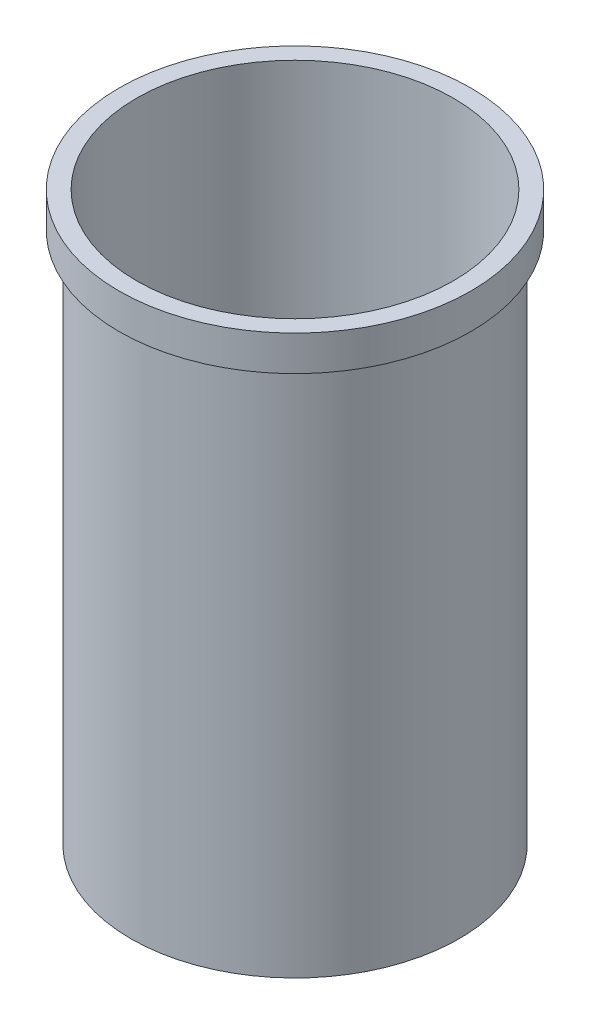
from build123d import *

# Parameters (mm, degrees)
SKETCH1_R           = 56.1
SKETCH1_R_2         = 54.1
BOSS_EXTRUDE1_DEPTH = 193.66
BOSS_EXTRUDE2_START = -12
SKETCH3_R           = 60.1
SKETCH3_R_2         = 56.1
BOSS_EXTRUDE2_DEPTH = 12


with BuildPart() as part:
    # Sketch1 → Boss-Extrude1 (new body)
    with BuildSketch(Plane(origin=(0, 0, 0), x_dir=(1, 0, 0), z_dir=(0, 1, 0))):
        Circle(SKETCH1_R)
        Circle(SKETCH1_R_2, mode=Mode.SUBTRACT)
    extrude(amount=BOSS_EXTRUDE1_DEPTH)

    # Sketch3 → Boss-Extrude2 (add)
    with BuildSketch(Plane(origin=(0, 193.66, 0), x_dir=(1, 0, 0), z_dir=(0, 1, 0)).offset(BOSS_EXTRUDE2_START)):
        Circle(SKETCH3_R)
        Circle(SKETCH3_R_2, mode=Mode.SUBTRACT)
    extrude(amount=BOSS_EXTRUDE2_DEPTH)


solid = part.part
